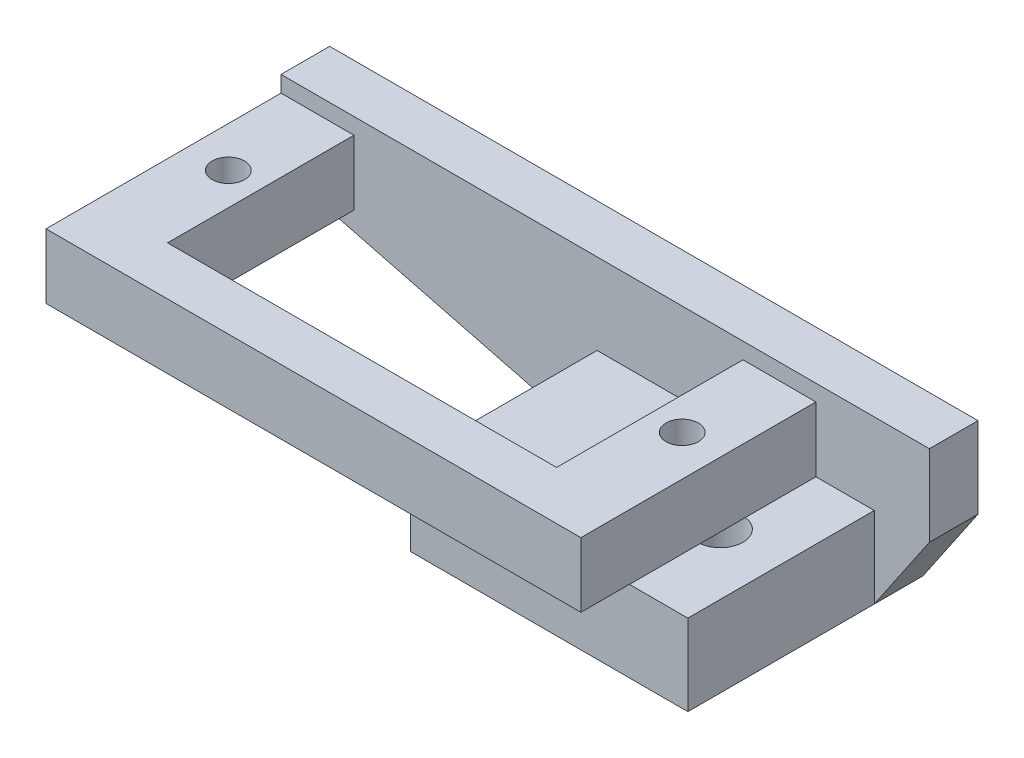
from build123d import *

# Parameters (mm, degrees)
SKETCH_1_W          = 40
SKETCH_1_H          = 5
EXTRUDE_1_DEPTH     = 3
SKETCH_2_W          = 4.5
SKETCH_2_H          = 4
EXTRUDE_2_DEPTH     = 11.5
SKETCH_4_R          = 1
CUT_EXTRUDE_1_DEPTH = 26.024987512
SKETCH_5_W          = 17.1
SKETCH_5_H          = 14.5
SKETCH_5_R          = 1.4
EXTRUDE_3_DEPTH     = 5
EXTRUDE_4_DEPTH     = 3
SKETCH_7_R          = 2.4
SKETCH_7_R_2        = 1.4
EXTRUDE_5_DEPTH     = 0.75
CHAMFER_1_SIZE      = 1
EXTRUDE_11_DEPTH    = 3.99


with BuildPart() as part:
    # Эскиз1 → Бобышка-Вытянуть1 (new body)
    with BuildSketch(Plane.XY):
        Rectangle(SKETCH_1_W, SKETCH_1_H)
    extrude(amount=EXTRUDE_1_DEPTH)

    # Эскиз2 → Бобышка-Вытянуть2 (add)
    with BuildSketch(Plane.XY.offset(3)):
        with Locations((-17.75, -0.5)):
            Rectangle(SKETCH_2_W, SKETCH_2_H)
        with Locations((10.75, -0.5)):
            Rectangle(SKETCH_2_W, SKETCH_2_H)
    extrude(amount=EXTRUDE_2_DEPTH)

    # Эскиз4 → Вырез-Вытянуть1 (cut, through all)
    with BuildSketch(Plane(origin=(0, 1.5, 0), x_dir=(1, 0, 0), z_dir=(0, 1, 0))):
        with Locations(Location((-17.5, -8.75, 0), (0, 0, 270))):
            Circle(SKETCH_4_R)
        with Locations(Location((10.5, -8.75, 0), (0, 0, 90))):
            Circle(SKETCH_4_R)
    extrude(amount=-CUT_EXTRUDE_1_DEPTH, mode=Mode.SUBTRACT)

    # Эскиз5 → Бобышка-Вытянуть3 (add)
    with BuildSketch(Plane.XZ.offset(2.5)):
        with Locations((8.05, 7.25)):
            Rectangle(SKETCH_5_W, SKETCH_5_H)
        with Locations(Location((12.85, 8.75, 0), (0, 0, 83.849360172))):
            Circle(SKETCH_5_R, mode=Mode.SUBTRACT)
    extrude(amount=EXTRUDE_3_DEPTH)

    # Эскиз6 → Бобышка-Вытянуть4 (add)
    with BuildSketch(Plane(origin=(0, 0, 0), x_dir=(-1, 0, 0), z_dir=(0, 0, -1))):
        Polygon((-20, -2.5), (-16.6, -7.5), (-16.6, -2.5), align=None)
        Polygon((20, -2.5), (0.5, -7.5), (0.5, -2.5), align=None)
    extrude(amount=-EXTRUDE_4_DEPTH)

    # Эскиз7 → Бобышка-Вытянуть5 (add)
    with BuildSketch(Plane.XZ.offset(7.5)):
        with Locations(Location((12.85, 8.75, 0), (0, 0, 270))):
            Circle(SKETCH_7_R)
        with Locations(Location((12.85, 8.75, 0), (0, 0, 83.849360172))):
            Circle(SKETCH_7_R_2, mode=Mode.SUBTRACT)
    extrude(amount=EXTRUDE_5_DEPTH)

    # Фаска1
    # the kernel refuses this chamfer: 1 mm, written as the material it adds along each edge
    with BuildSketch(Plane(origin=(12.85, -7.5, 8.75), x_dir=(0, 0, -1), z_dir=(-1, 0, 0))) as chamfer_1_piece_1_section:
        Polygon((2.4 + CHAMFER_1_SIZE, 0), (2.4, CHAMFER_1_SIZE), (2.4, 0), align=None)
    chamfer_1_piece_1 = revolve(axis=Axis((12.85, -7.5, 8.75), (0, -1, 0)), mode=Mode.PRIVATE)
    chamfer_1_piece_1 = split(chamfer_1_piece_1, bisect_by=Plane(origin=(12.85, -8.25, 8.75), z_dir=(0, 1, 0)), keep=Keep.TOP, mode=Mode.PRIVATE)
    add(chamfer_1_piece_1)

    # Эскиз8 → Бобышка-Вытянуть11 (add)
    with BuildSketch(Plane(origin=(0, 1.5, 0), x_dir=(1, 0, 0), z_dir=(0, 1, 0))):
        Polygon((-15.5, -14.5), (-20, -14.5), (-20, -17.5), (13, -17.5), (13, -14.5), align=None)
    extrude(amount=-EXTRUDE_11_DEPTH)


solid = part.part
